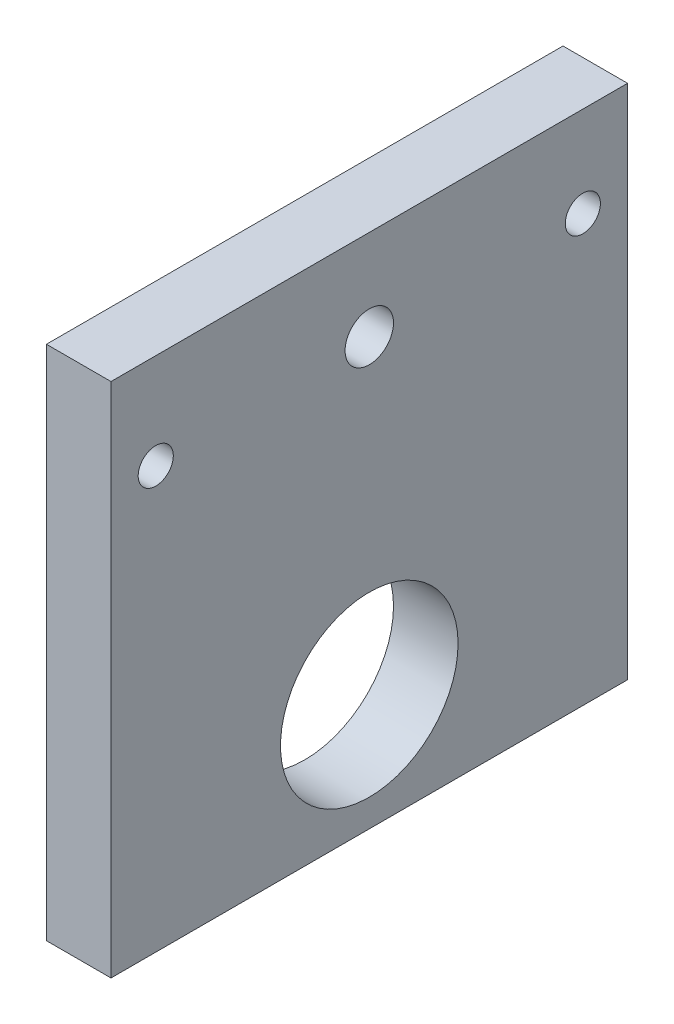
from build123d import *

# Parameters (mm, degrees)
SKETCH1_W                           = 50.8
SKETCH1_H                           = 50.8
BOSS_EXTRUDE1_DEPTH                 = 6.35
F_11_16_0_6875_DIAMETER_HOLE1_D     = 17.4625
F_11_16_0_6875_DIAMETER_HOLE1_DEPTH = 70.104
F_11_16_0_6875_DIAMETER_HOLE1_TIP   = 5.24626428
F_3_16_0_1875_DIAMETER_HOLE1_D      = 4.7625
F_3_16_0_1875_DIAMETER_HOLE1_DEPTH  = 70.104
F_3_16_0_1875_DIAMETER_HOLE1_TIP    = 1.430799349
F_29_0_136_DIAMETER_HOLE1_D         = 3.4544
F_29_0_136_DIAMETER_HOLE1_DEPTH     = 70.104
F_29_0_136_DIAMETER_HOLE1_TIP       = 1.037806461


with BuildPart() as part:
    # Sketch1 → Boss-Extrude1 (new body)
    with BuildSketch(Plane(origin=(0, 0, 0), x_dir=(0, 0, -1), z_dir=(1, 0, 0))):
        Rectangle(SKETCH1_W, SKETCH1_H)
    extrude(amount=BOSS_EXTRUDE1_DEPTH)

    # 11/16 (0.6875) Diameter Hole1
    with Locations(Plane(origin=(6.35, 0, 0), x_dir=(0, 0, -1), z_dir=(1, 0, 0))):
        with Locations((0, -13.97)):
            Hole(F_11_16_0_6875_DIAMETER_HOLE1_D / 2, depth=F_11_16_0_6875_DIAMETER_HOLE1_DEPTH)
            with Locations((0, 0, -(F_11_16_0_6875_DIAMETER_HOLE1_DEPTH + F_11_16_0_6875_DIAMETER_HOLE1_TIP / 2))):  # 118° drill point
                Cone(0, F_11_16_0_6875_DIAMETER_HOLE1_D / 2, F_11_16_0_6875_DIAMETER_HOLE1_TIP, mode=Mode.SUBTRACT)

    # 3/16 (0.1875) Diameter Hole1
    with Locations(Plane(origin=(6.35, 0, 0), x_dir=(0, 0, -1), z_dir=(1, 0, 0))):
        with Locations((0, 16.51)):
            Hole(F_3_16_0_1875_DIAMETER_HOLE1_D / 2, depth=F_3_16_0_1875_DIAMETER_HOLE1_DEPTH)
            with Locations((0, 0, -(F_3_16_0_1875_DIAMETER_HOLE1_DEPTH + F_3_16_0_1875_DIAMETER_HOLE1_TIP / 2))):  # 118° drill point
                Cone(0, F_3_16_0_1875_DIAMETER_HOLE1_D / 2, F_3_16_0_1875_DIAMETER_HOLE1_TIP, mode=Mode.SUBTRACT)

    # #29 (0.136) Diameter Hole1
    with Locations(Plane(origin=(6.35, 0, 0), x_dir=(0, 0, -1), z_dir=(1, 0, 0))):
        with Locations((21, 16.51), (-21, 16.02135915)):
            Hole(F_29_0_136_DIAMETER_HOLE1_D / 2, depth=F_29_0_136_DIAMETER_HOLE1_DEPTH)
            with Locations((0, 0, -(F_29_0_136_DIAMETER_HOLE1_DEPTH + F_29_0_136_DIAMETER_HOLE1_TIP / 2))):  # 118° drill point
                Cone(0, F_29_0_136_DIAMETER_HOLE1_D / 2, F_29_0_136_DIAMETER_HOLE1_TIP, mode=Mode.SUBTRACT)


solid = part.part
